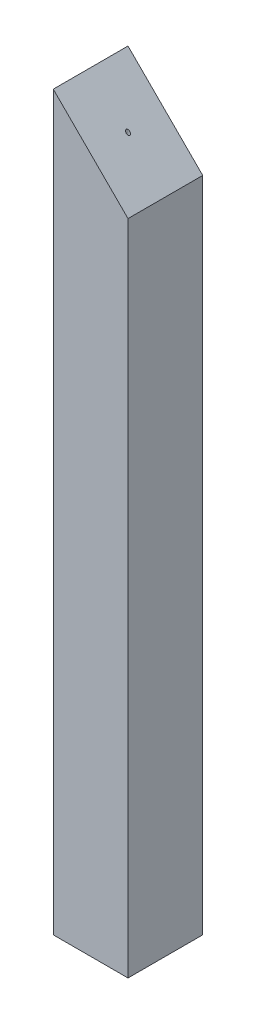
from build123d import *

# Parameters (mm, degrees)
SKETCH1_W               = 25.4
SKETCH1_H               = 25.4
BOSS_EXTRUDE1_DEPTH     = 124.485
CUT_EXTRUDE1_DEPTH      = 126.773984691
CUT_EXTRUDE1_DEPTH_BACK = 126.773984691


with BuildPart() as part:
    # Sketch1 → Boss-Extrude1 (new, symmetric)
    with BuildSketch(Plane(origin=(0, 0, 0), x_dir=(1, 0, 0), z_dir=(0, 1, 0))):
        Rectangle(SKETCH1_W, SKETCH1_H)
    extrude(amount=BOSS_EXTRUDE1_DEPTH, both=True)

    # Sketch3 → #0-80 Tapped Hole1 (revolve, cut)
    with BuildSketch(Plane(origin=(0, -124.485, 0), x_dir=(0, 0, -1), z_dir=(1, 0, 0))):
        Polygon((0, 0), (0, 20.357890611), (0.59563, 20), (0.59563, 0.768338359), (1.5113, 0), align=None)
    f_0_80_tapped_hole1 = revolve(axis=Axis((0, -130.835, 0), (0, 1, 0)), mode=Mode.SUBTRACT)

    # Mirror1: #0-80 Tapped Hole1 across plane
    add(f_0_80_tapped_hole1.mirror(Plane.ZX), mode=Mode.SUBTRACT)

    # Sketch4 → Cut-Extrude1 (cut, two sides: drawn at the far end of the back side and taken through both)
    with BuildSketch(Plane.XY.offset(-CUT_EXTRUDE1_DEPTH_BACK)):
        Polygon((12.7, 124.485), (-12.7, 124.485), (12.7, 99.085), align=None)
    extrude(amount=CUT_EXTRUDE1_DEPTH + CUT_EXTRUDE1_DEPTH_BACK, mode=Mode.SUBTRACT)


solid = part.part
